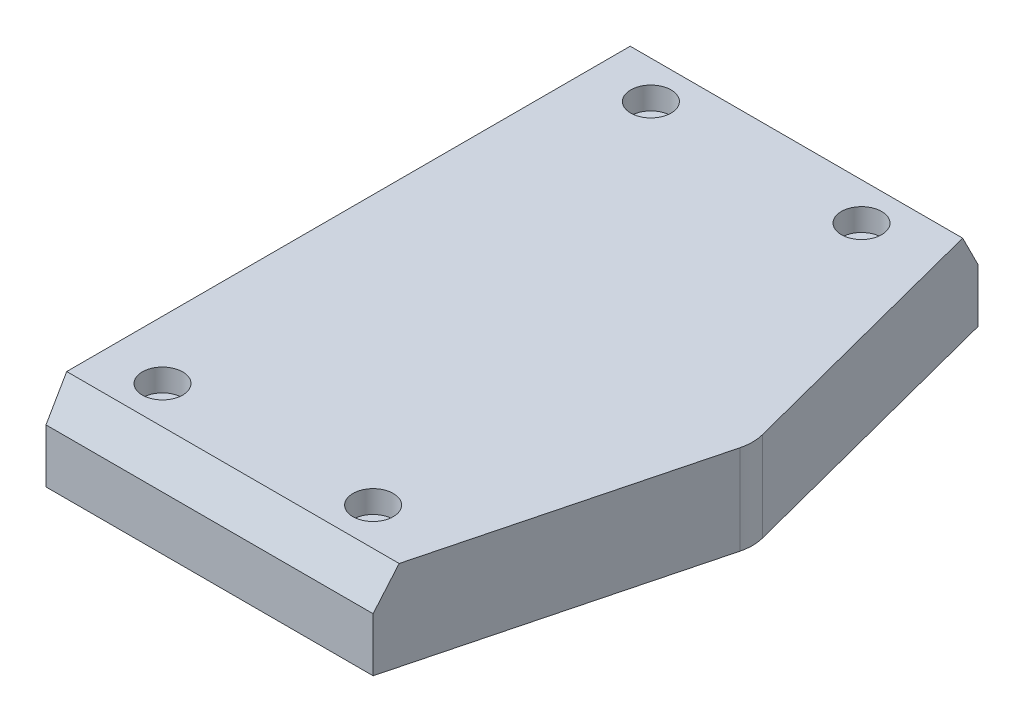
from build123d import *
from OCP.BRepFilletAPI import BRepFilletAPI_MakeChamfer

# Parameters (mm, degrees)
SALIENTE_EXTRUIR2_DEPTH     = 23
CROQUIS7_R                  = 20
CORTAR_EXTRUIR1_DEPTH       = 16
CROQUIS8_R                  = 10.25
CORTAR_EXTRUIR2_DEPTH       = 65.838641661
SALIENTE_EXTRUIR3_START     = 32
CROQUIS9_R                  = 20
CROQUIS9_R_2                = 3.075
CROQUIS9_R_3                = 10.25
SALIENTE_EXTRUIR3_DEPTH     = 32
CORTAR_EXTRUIR3_START       = -7
CROQUIS10_R                 = 20
CORTAR_EXTRUIR3_DEPTH       = 112.607172695
SALIENTE_EXTRUIR4_START     = 20
CROQUIS11_R                 = 3.075
CROQUIS11_R_2               = 20
SALIENTE_EXTRUIR4_DEPTH     = 20
CROQUIS12_R                 = 63
CORTAR_EXTRUIR4_DEPTH       = 3
CROQUIS13_R                 = 55
CORTAR_EXTRUIR5_DEPTH       = 10
SALIENTE_EXTRUIR5_START     = 10
SALIENTE_EXTRUIR5_DEPTH     = 10
CHAFL_N1_SIZE               = 8
CHAFL_N1_SIZE2              = 4.618802154
CROQUIS15_R                 = 6
CORTAR_EXTRUIR6_DEPTH       = 14.8
CORTAR_EXTRUIR7_REACH       = 233.334
CROQUIS17_R                 = 1.5
CORTAR_EXTRUIR9_REACH       = 225.907
CROQUIS19_R                 = 1.5
CORTAR_EXTRUIR10_START      = -50
CORTAR_EXTRUIR10_DEPTH      = 50
CROQUIS22_R                 = 3
CORTAR_EXTRUIR12_DEPTH      = 3
CROQUIS23_R                 = 3
CORTAR_EXTRUIR13_DEPTH      = 3
CROQUIS25_R                 = 2.5
CORTAR_EXTRUIR15_DEPTH      = 30
CROQUIS24_R                 = 2.5
CORTAR_EXTRUIR14_DEPTH      = 30
CROQUIS26_R                 = 2
CORTAR_EXTRUIR16_DEPTH      = 223.070371729
CROQUIS27_R                 = 3.5
CORTAR_EXTRUIR17_DEPTH      = 5
CORTAR_EXTRUIR18_DEPTH      = 3.25
CORTAR_EXTRUIR20_DEPTH      = 223.070371729
CORTAR_EXTRUIR20_DEPTH_BACK = 10
CROQUIS31_R                 = 2.5
CORTAR_EXTRUIR21_DEPTH      = 217.079267863
CROQUIS32_R                 = 4.5
CORTAR_EXTRUIR22_DEPTH      = 5
SALIENTE_EXTRUIR6_START     = 4
CROQUIS33_R                 = 55
CROQUIS33_R_2               = 6
SALIENTE_EXTRUIR6_DEPTH     = 4
SALIENTE_EXTRUIR7_START     = 3.35
CROQUIS34_R                 = 16.85
CROQUIS34_R_2               = 6
SALIENTE_EXTRUIR7_DEPTH     = 3.35
SALIENTE_EXTRUIR8_START     = 29
CROQUIS35_R                 = 10
CROQUIS35_R_2               = 6
SALIENTE_EXTRUIR8_DEPTH     = 29
CORTAR_EXTRUIR23_DEPTH      = 218.721088781
CORTAR_EXTRUIR23_DEPTH_BACK = 218.721088781
CROQUIS36_OUTSIDE_W         = 281.136
CROQUIS36_OUTSIDE_H         = 190.636
SALIENTE_EXTRUIR9_REACH     = 117.947
CROQUIS37_R                 = 20
VACIADO1_START              = 65
VACIADO1_DEPTH              = 12
VACIADO1_2_DEPTH            = 7
VACIADO1_START_2            = -12.766907344
VACIADO1_3_DEPTH            = 28.533814688


with BuildPart() as part:
    # Croquis2 → Saliente-Extruir2 (new body)
    with BuildSketch(Plane(origin=(0, 0, 0), x_dir=(1, 0, 0), z_dir=(0, 1, 0))):
        with BuildLine():
            Line((32.725022686, -35), (-35, -35))
            Line((-35, -35), (-35, 35))
            Line((-35, 35), (38, 35))
            Line((38, 35), (52.182846342, -19.705264464))
            ThreePointArc((52.182846342, -19.705264464), (38.869791903, -20.762030653), (32.5, -32.5))
            ThreePointArc((32.5, -32.5), (32.556369153, -33.755053307), (32.725022686, -35))
        make_face()
    extrude(amount=SALIENTE_EXTRUIR2_DEPTH)

    # Croquis7 → Cortar-Extruir1 (cut)
    with BuildSketch(Plane(origin=(0, 23, 0), x_dir=(1, 0, 0), z_dir=(0, 1, 0))):
        with Locations(Location((1.5, -1.5, 0), (0, 0, 270))):
            Circle(CROQUIS7_R)
    extrude(amount=-CORTAR_EXTRUIR1_DEPTH, mode=Mode.SUBTRACT)

    # Croquis8 → Cortar-Extruir2 (cut, through all)
    with BuildSketch(Plane(origin=(0, 7, 0), x_dir=(1, 0, 0), z_dir=(0, 1, 0))):
        with Locations(Location((1.5, -1.5, 0), (0, 0, 270))):
            Circle(CROQUIS8_R)
    extrude(amount=-CORTAR_EXTRUIR2_DEPTH, mode=Mode.SUBTRACT)

    # Croquis9 → Saliente-Extruir3 (add)
    with BuildSketch(Plane(origin=(0, 23, 0), x_dir=(1, 0, 0), z_dir=(0, 1, 0)).offset(SALIENTE_EXTRUIR3_START)):
        with BuildLine():
            Line((-35, 35), (-35, -100))
            Line((-35, -100), (38, -100))
            Line((38, -100), (54.849357366, -35.009621588))
            ThreePointArc((54.849357366, -35.009621588), (55.169388384, -32.5), (54.849357366, -29.990378412))
            Line((54.849357366, -29.990378412), (38, 35))
            Line((38, 35), (-35, 35))
        make_face()
        with Locations(Location((1.5, -1.5, 0), (0, 0, 270))):
            Circle(CROQUIS9_R, mode=Mode.SUBTRACT)
        with Locations(Location((46.5, -32.5, 0), (0, 0, 270))):
            Circle(CROQUIS9_R_2, mode=Mode.SUBTRACT)
        with Locations(Location((1.5, -63.5, 0), (0, 0, 90))):
            Circle(CROQUIS9_R_3, mode=Mode.SUBTRACT)
    extrude(amount=-SALIENTE_EXTRUIR3_DEPTH)

    # Croquis10 → Cortar-Extruir3 (cut, through all)
    with BuildSketch(Plane.XZ.offset(-23).offset(CORTAR_EXTRUIR3_START)):
        with Locations(Location((1.5, 63.5, 0), (0, 0, 90))):
            Circle(CROQUIS10_R)
    extrude(amount=-CORTAR_EXTRUIR3_DEPTH, mode=Mode.SUBTRACT)

    # Croquis11 → Saliente-Extruir4 (add)
    with BuildSketch(Plane(origin=(0, 55, 0), x_dir=(1, 0, 0), z_dir=(0, 1, 0)).offset(SALIENTE_EXTRUIR4_START)):
        with BuildLine():
            Line((123, 35), (-35, 35))
            Line((-35, 35), (-35, -100))
            Line((-35, -100), (123, -100))
            ThreePointArc((123, -100), (190.5, -32.5), (123, 35))
        make_face()
        with Locations(Location((46.5, -32.5, 0), (0, 0, 270))):
            Circle(CROQUIS11_R, mode=Mode.SUBTRACT)
        with Locations(Location((1.5, -63.5, 0), (0, 0, 270))):
            Circle(CROQUIS11_R_2, mode=Mode.SUBTRACT)
        with Locations(Location((1.5, -1.5, 0), (0, 0, 270))):
            Circle(CROQUIS11_R_2, mode=Mode.SUBTRACT)
    extrude(amount=-SALIENTE_EXTRUIR4_DEPTH)

    # Croquis12 → Cortar-Extruir4 (cut)
    with BuildSketch(Plane.XZ.offset(-55)):
        with Locations(Location((123, 32.5, 0), (0, 0, 270))):
            Circle(CROQUIS12_R)
    extrude(amount=-CORTAR_EXTRUIR4_DEPTH, mode=Mode.SUBTRACT)

    # Croquis13 → Cortar-Extruir5 (cut)
    with BuildSketch(Plane.XZ.offset(-58)):
        with Locations(Location((123, 32.5, 0), (0, 0, 270))):
            Circle(CROQUIS13_R)
    extrude(amount=-CORTAR_EXTRUIR5_DEPTH, mode=Mode.SUBTRACT)

    # Croquis14 → Saliente-Extruir5 (add)
    with BuildSketch(Plane(origin=(0, 75, 0), x_dir=(1, 0, 0), z_dir=(0, 1, 0)).offset(SALIENTE_EXTRUIR5_START)):
        with BuildLine():
            Line((-35, -100), (123, -100))
            ThreePointArc((123, -100), (190.5, -32.5), (123, 35))
            Line((123, 35), (-35, 35))
            Line((-35, 35), (-35, -100))
        make_face()
    extrude(amount=-SALIENTE_EXTRUIR5_DEPTH)

    # Chaflán1: one chamfer whose edges measure the first distance from different faces: ONE call of the kernel's chamfer builder (chamfer() names one face for all edges)
    chafl_n1_edges_1 = [part.edges().sort_by_distance(p)[0] for p in [
        (190.5, 85, 32.5),
    ]]
    chafl_n1_side_1 = [part.faces().sort_by_distance(p)[0] for p in [
        (190.5, 70, 32.5),
    ]]
    chafl_n1_edges_2 = [part.edges().sort_by_distance(p)[0] for p in [
        (44, 85, -35),
    ]]
    chafl_n1_side_2 = [part.faces().sort_by_distance(p)[0] for p in [
        (24.509708738, 50.509708738, -35),
    ]]
    chafl_n1_edges_3 = [part.edges().sort_by_distance(p)[0] for p in [
        (44, 85, 100),
    ]]
    chafl_n1_side_3 = [part.faces().sort_by_distance(p)[0] for p in [
        (29.969474279, 59.765969474, 100),
    ]]
    chafl_n1 = BRepFilletAPI_MakeChamfer(part.part.solid().wrapped)
    for e in chafl_n1_edges_1:
        chafl_n1.Add(CHAFL_N1_SIZE, CHAFL_N1_SIZE2, e.wrapped, chafl_n1_side_1[0].wrapped)  # the first distance lies on this face
    for e in chafl_n1_edges_2:
        chafl_n1.Add(CHAFL_N1_SIZE, CHAFL_N1_SIZE2, e.wrapped, chafl_n1_side_2[0].wrapped)  # the first distance lies on this face
    for e in chafl_n1_edges_3:
        chafl_n1.Add(CHAFL_N1_SIZE, CHAFL_N1_SIZE2, e.wrapped, chafl_n1_side_3[0].wrapped)  # the first distance lies on this face
    add(Compound.cast(chafl_n1.Shape()), mode=Mode.REPLACE)

    # Croquis15 → Cortar-Extruir6 (cut)
    with BuildSketch(Plane.XZ.offset(-68)):
        with Locations(Location((123, 32.5, 0), (0, 0, 270))):
            Circle(CROQUIS15_R)
    extrude(amount=-CORTAR_EXTRUIR6_DEPTH, mode=Mode.SUBTRACT)

    # Croquis17 → Cortar-Extruir7 (cut, up to next)
    with BuildSketch(Plane.XZ, mode=Mode.PRIVATE) as cortar_extruir7_sk1:
        with Locations(Location((16.5, 1.5, 0), (0, 0, 270))):
            Circle(CROQUIS17_R)
    cortar_extruir7_tool1 = extrude(cortar_extruir7_sk1.sketch, amount=-CORTAR_EXTRUIR7_REACH, mode=Mode.PRIVATE) & part.part
    # Croquis17 → Cortar-Extruir7 (cut, up to next)
    with BuildSketch(Plane.XZ, mode=Mode.PRIVATE) as cortar_extruir7_sk2:
        with Locations(Location((-6, -11.490381057, 0), (0, 0, 270))):
            Circle(CROQUIS17_R)
    cortar_extruir7_tool2 = extrude(cortar_extruir7_sk2.sketch, amount=-CORTAR_EXTRUIR7_REACH, mode=Mode.PRIVATE) & part.part
    # Croquis17 → Cortar-Extruir7 (cut, up to next)
    with BuildSketch(Plane.XZ, mode=Mode.PRIVATE) as cortar_extruir7_sk3:
        with Locations(Location((-6, 14.490381057, 0), (0, 0, 270))):
            Circle(CROQUIS17_R)
    cortar_extruir7_tool3 = extrude(cortar_extruir7_sk3.sketch, amount=-CORTAR_EXTRUIR7_REACH, mode=Mode.PRIVATE) & part.part
    # Croquis17 → Cortar-Extruir7 (cut, up to next)
    with BuildSketch(Plane.XZ, mode=Mode.PRIVATE) as cortar_extruir7_sk4:
        with Locations(Location((13.624355653, 8.5, 0), (0, 0, 270))):
            Circle(CROQUIS17_R)
    cortar_extruir7_tool4 = extrude(cortar_extruir7_sk4.sketch, amount=-CORTAR_EXTRUIR7_REACH, mode=Mode.PRIVATE) & part.part
    # Croquis17 → Cortar-Extruir7 (cut, up to next)
    with BuildSketch(Plane.XZ, mode=Mode.PRIVATE) as cortar_extruir7_sk5:
        with Locations(Location((1.5, -12.5, 0), (0, 0, 270))):
            Circle(CROQUIS17_R)
    cortar_extruir7_tool5 = extrude(cortar_extruir7_sk5.sketch, amount=-CORTAR_EXTRUIR7_REACH, mode=Mode.PRIVATE) & part.part
    # Croquis17 → Cortar-Extruir7 (cut, up to next)
    with BuildSketch(Plane.XZ, mode=Mode.PRIVATE) as cortar_extruir7_sk6:
        with Locations(Location((-10.624355653, 8.5, 0), (0, 0, 270))):
            Circle(CROQUIS17_R)
    cortar_extruir7_tool6 = extrude(cortar_extruir7_sk6.sketch, amount=-CORTAR_EXTRUIR7_REACH, mode=Mode.PRIVATE) & part.part
    add(cortar_extruir7_tool1.solids().sort_by_distance((16.5, 0, 1.5))[0], mode=Mode.SUBTRACT)
    add(cortar_extruir7_tool2.solids().sort_by_distance((-6, 0, -11.490381))[0], mode=Mode.SUBTRACT)
    add(cortar_extruir7_tool3.solids().sort_by_distance((-6, 0, 14.490381))[0], mode=Mode.SUBTRACT)
    add(cortar_extruir7_tool4.solids().sort_by_distance((13.624356, 0, 8.5))[0], mode=Mode.SUBTRACT)
    add(cortar_extruir7_tool5.solids().sort_by_distance((1.5, 0, -12.5))[0], mode=Mode.SUBTRACT)
    add(cortar_extruir7_tool6.solids().sort_by_distance((-10.624356, 0, 8.5))[0], mode=Mode.SUBTRACT)

    # Croquis19 → Cortar-Extruir9 (cut, up to next)
    with BuildSketch(Plane.XZ.offset(-23), mode=Mode.PRIVATE) as cortar_extruir9_sk1:
        with Locations(Location((16.5, 63.5, 0), (0, 0, 270))):
            Circle(CROQUIS19_R)
    cortar_extruir9_tool1 = extrude(cortar_extruir9_sk1.sketch, amount=-CORTAR_EXTRUIR9_REACH, mode=Mode.PRIVATE) & part.part
    # Croquis19 → Cortar-Extruir9 (cut, up to next)
    with BuildSketch(Plane.XZ.offset(-23), mode=Mode.PRIVATE) as cortar_extruir9_sk2:
        with Locations(Location((-6, 50.509618943, 0), (0, 0, 270))):
            Circle(CROQUIS19_R)
    cortar_extruir9_tool2 = extrude(cortar_extruir9_sk2.sketch, amount=-CORTAR_EXTRUIR9_REACH, mode=Mode.PRIVATE) & part.part
    # Croquis19 → Cortar-Extruir9 (cut, up to next)
    with BuildSketch(Plane.XZ.offset(-23), mode=Mode.PRIVATE) as cortar_extruir9_sk3:
        with Locations(Location((-6, 76.490381057, 0), (0, 0, 270))):
            Circle(CROQUIS19_R)
    cortar_extruir9_tool3 = extrude(cortar_extruir9_sk3.sketch, amount=-CORTAR_EXTRUIR9_REACH, mode=Mode.PRIVATE) & part.part
    # Croquis19 → Cortar-Extruir9 (cut, up to next)
    with BuildSketch(Plane.XZ.offset(-23), mode=Mode.PRIVATE) as cortar_extruir9_sk4:
        with Locations(Location((13.624355653, 70.5, 0), (0, 0, 270))):
            Circle(CROQUIS19_R)
    cortar_extruir9_tool4 = extrude(cortar_extruir9_sk4.sketch, amount=-CORTAR_EXTRUIR9_REACH, mode=Mode.PRIVATE) & part.part
    # Croquis19 → Cortar-Extruir9 (cut, up to next)
    with BuildSketch(Plane.XZ.offset(-23), mode=Mode.PRIVATE) as cortar_extruir9_sk5:
        with Locations(Location((1.5, 49.5, 0), (0, 0, 270))):
            Circle(CROQUIS19_R)
    cortar_extruir9_tool5 = extrude(cortar_extruir9_sk5.sketch, amount=-CORTAR_EXTRUIR9_REACH, mode=Mode.PRIVATE) & part.part
    # Croquis19 → Cortar-Extruir9 (cut, up to next)
    with BuildSketch(Plane.XZ.offset(-23), mode=Mode.PRIVATE) as cortar_extruir9_sk6:
        with Locations(Location((-10.624355653, 70.5, 0), (0, 0, 270))):
            Circle(CROQUIS19_R)
    cortar_extruir9_tool6 = extrude(cortar_extruir9_sk6.sketch, amount=-CORTAR_EXTRUIR9_REACH, mode=Mode.PRIVATE) & part.part
    add(cortar_extruir9_tool1.solids().sort_by_distance((16.5, 23, 63.5))[0], mode=Mode.SUBTRACT)
    add(cortar_extruir9_tool2.solids().sort_by_distance((-6, 23, 50.509619))[0], mode=Mode.SUBTRACT)
    add(cortar_extruir9_tool3.solids().sort_by_distance((-6, 23, 76.490381))[0], mode=Mode.SUBTRACT)
    add(cortar_extruir9_tool4.solids().sort_by_distance((13.624356, 23, 70.5))[0], mode=Mode.SUBTRACT)
    add(cortar_extruir9_tool5.solids().sort_by_distance((1.5, 23, 49.5))[0], mode=Mode.SUBTRACT)
    add(cortar_extruir9_tool6.solids().sort_by_distance((-10.624356, 23, 70.5))[0], mode=Mode.SUBTRACT)

    # Croquis20 → Cortar-Extruir10 (cut)
    with BuildSketch(Plane.XZ.offset(CORTAR_EXTRUIR10_START)):
        with BuildLine():
            Line((42.3656995, 5.747113524), (39.773106907, -4.252886476))
            ThreePointArc((39.773106907, -4.252886476), (38.705054743, -5.872620854), (36.869116213, -6.5))
            Line((36.869116213, -6.5), (19.83030278, -6.5))
            ThreePointArc((19.83030278, -6.5), (21.5, 1.5), (19.83030278, 9.5))
            Line((19.83030278, 9.5), (39.461708805, 9.5))
            ThreePointArc((39.461708805, 9.5), (41.834329659, 8.33593853), (42.3656995, 5.747113524))
        make_face()
    extrude(amount=CORTAR_EXTRUIR10_DEPTH, mode=Mode.SUBTRACT)

    # Croquis22 → Cortar-Extruir12 (cut)
    with BuildSketch(Plane.XZ):
        with Locations(Location((-6, 14.490381057, 0), (0, 0, 270))):
            Circle(CROQUIS22_R)
        with Locations(Location((-10.624355653, 8.5, 0), (0, 0, 270))):
            Circle(CROQUIS22_R)
        with Locations(Location((-6, -11.490381057, 0), (0, 0, 270))):
            Circle(CROQUIS22_R)
        with Locations(Location((1.5, -12.5, 0), (0, 0, 270))):
            Circle(CROQUIS22_R)
        with Locations(Location((16.5, 1.5, 0), (0, 0, 270))):
            Circle(CROQUIS22_R)
        with Locations(Location((13.624355653, 8.5, 0), (0, 0, 270))):
            Circle(CROQUIS22_R)
    extrude(amount=-CORTAR_EXTRUIR12_DEPTH, mode=Mode.SUBTRACT)

    # Croquis23 → Cortar-Extruir13 (cut)
    with BuildSketch(Plane.XZ.offset(-23)):
        with Locations(Location((-6, 76.490381057, 0), (0, 0, 270))):
            Circle(CROQUIS23_R)
        with Locations(Location((-10.624355653, 70.5, 0), (0, 0, 270))):
            Circle(CROQUIS23_R)
        with Locations(Location((-6, 50.509618943, 0), (0, 0, 270))):
            Circle(CROQUIS23_R)
        with Locations(Location((1.5, 49.5, 0), (0, 0, 270))):
            Circle(CROQUIS23_R)
        with Locations(Location((16.5, 63.5, 0), (0, 0, 270))):
            Circle(CROQUIS23_R)
        with Locations(Location((13.624355653, 70.5, 0), (0, 0, 270))):
            Circle(CROQUIS23_R)
    extrude(amount=-CORTAR_EXTRUIR13_DEPTH, mode=Mode.SUBTRACT)

    # Croquis25 → Cortar-Extruir15 (cut)
    with BuildSketch(Plane.XZ.offset(-23)):
        with Locations(Location((-28.75, 63.5, 0), (0, 0, 270))):
            Circle(CROQUIS25_R)
        with Locations(Location((29, 47, 0), (0, 0, 270))):
            Circle(CROQUIS25_R)
    extrude(amount=-CORTAR_EXTRUIR15_DEPTH, mode=Mode.SUBTRACT)

    # Croquis24 → Cortar-Extruir14 (cut)
    with BuildSketch(Plane.XZ):
        with Locations(Location((-28.75, 1.5, 0), (0, 0, 270))):
            Circle(CROQUIS24_R)
        with Locations(Location((25, 25, 0), (0, 0, 270))):
            Circle(CROQUIS24_R)
    extrude(amount=-CORTAR_EXTRUIR14_DEPTH, mode=Mode.SUBTRACT)

    # Croquis26 → Cortar-Extruir16 (cut, through all)
    with BuildSketch(Plane.XZ.offset(-55)):
        with Locations(Location((54.186793756, 85.381197846, 0), (0, 0, 270))):
            Circle(CROQUIS26_R)
        with Locations(Location((58.853460423, 67.381197846, 0), (0, 0, 270))):
            Circle(CROQUIS26_R)
        with Locations(Location((58.853460423, -2.381197846, 0), (0, 0, 90))):
            Circle(CROQUIS26_R)
        with Locations(Location((54.186793756, -20.381197846, 0), (0, 0, 90))):
            Circle(CROQUIS26_R)
    extrude(amount=-CORTAR_EXTRUIR16_DEPTH, mode=Mode.SUBTRACT)

    # Croquis27 → Cortar-Extruir17 (cut)
    with BuildSketch(Plane(origin=(0, 85, 0), x_dir=(1, 0, 0), z_dir=(0, 1, 0))):
        with Locations(Location((54.186793756, 20.381197846, 0), (0, 0, 270))):
            Circle(CROQUIS27_R)
        with Locations(Location((58.853460423, 2.381197846, 0), (0, 0, 270))):
            Circle(CROQUIS27_R)
        with Locations(Location((58.853460423, -67.381197846, 0), (0, 0, 270))):
            Circle(CROQUIS27_R)
        with Locations(Location((54.186793756, -85.381197846, 0), (0, 0, 270))):
            Circle(CROQUIS27_R)
    extrude(amount=-CORTAR_EXTRUIR17_DEPTH, mode=Mode.SUBTRACT)

    # Croquis28 → Cortar-Extruir18 (cut)
    with BuildSketch(Plane.XZ.offset(-55)):
        Polygon((55.222779206, 81.385253968), (58.165375392, 84.280415625), (57.129389942, 88.276359503), (53.150808306, 89.377141725), (50.20821212, 86.481980068), (51.24419757, 82.48603619), align=None)
        Polygon((59.889445873, 63.385253968), (62.832042059, 66.280415625), (61.796056609, 70.276359503), (57.817474973, 71.377141725), (54.874878787, 68.481980068), (55.910864237, 64.48603619), align=None)
        Polygon((59.889445873, 1.614746032), (55.910864237, 0.51396381), (54.874878787, -3.481980068), (57.817474973, -6.377141725), (61.796056609, -5.276359503), (62.832042059, -1.280415625), align=None)
        Polygon((55.222779206, -16.385253968), (51.24419757, -17.48603619), (50.20821212, -21.481980068), (53.150808306, -24.377141725), (57.129389942, -23.276359503), (58.165375392, -19.280415625), align=None)
    extrude(amount=-CORTAR_EXTRUIR18_DEPTH, mode=Mode.SUBTRACT)

    # Croquis30 → Cortar-Extruir20 (cut, two sides: drawn at the far end of the back side and taken through both)
    with BuildSketch(Plane.XZ.offset(-55).offset(-CORTAR_EXTRUIR20_DEPTH_BACK)):
        with BuildLine():
            Line((123, 100), (-35, 100))
            Line((-35, 100), (-35, -35))
            Line((-35, -35), (123, -35))
            ThreePointArc((123, -35), (55.5, 32.5), (123, 100))
        make_face()
    extrude(amount=CORTAR_EXTRUIR20_DEPTH + CORTAR_EXTRUIR20_DEPTH_BACK, mode=Mode.SUBTRACT)

    # Croquis31 → Cortar-Extruir21 (cut, through all)
    with BuildSketch(Plane.XZ.offset(-65)):
        with Locations(Location((-22, 87, 0), (0, 0, 270))):
            Circle(CROQUIS31_R)
        with Locations(Location((25, 87, 0), (0, 0, 270))):
            Circle(CROQUIS31_R)
        with Locations(Location((25, -22, 0), (0, 0, 90))):
            Circle(CROQUIS31_R)
        with Locations(Location((-22, -22, 0), (0, 0, 90))):
            Circle(CROQUIS31_R)
    extrude(amount=-CORTAR_EXTRUIR21_DEPTH, mode=Mode.SUBTRACT)

    # Croquis32 → Cortar-Extruir22 (cut)
    with BuildSketch(Plane(origin=(0, 85, 0), x_dir=(1, 0, 0), z_dir=(0, 1, 0))):
        with Locations(Location((-22, 22, 0), (0, 0, 270))):
            Circle(CROQUIS32_R)
        with Locations(Location((25, 22, 0), (0, 0, 270))):
            Circle(CROQUIS32_R)
        with Locations(Location((-22, -87, 0), (0, 0, 270))):
            Circle(CROQUIS32_R)
        with Locations(Location((25, -87, 0), (0, 0, 270))):
            Circle(CROQUIS32_R)
    extrude(amount=-CORTAR_EXTRUIR22_DEPTH, mode=Mode.SUBTRACT)

    # Croquis33 → Saliente-Extruir6 (add)
    with BuildSketch(Plane.XZ.offset(-68).offset(SALIENTE_EXTRUIR6_START)):
        with Locations(Location((123, 32.5, 0), (0, 0, 270))):
            Circle(CROQUIS33_R)
        with Locations(Location((123, 32.5, 0), (0, 0, 270))):
            Circle(CROQUIS33_R_2, mode=Mode.SUBTRACT)
    extrude(amount=-SALIENTE_EXTRUIR6_DEPTH)

    # Croquis34 → Saliente-Extruir7 (add)
    with BuildSketch(Plane.XZ.offset(-64).offset(SALIENTE_EXTRUIR7_START)):
        with Locations(Location((123, 32.5, 0), (0, 0, 270))):
            Circle(CROQUIS34_R)
        with Locations(Location((123, 32.5, 0), (0, 0, 270))):
            Circle(CROQUIS34_R_2, mode=Mode.SUBTRACT)
    extrude(amount=-SALIENTE_EXTRUIR7_DEPTH)

    # Croquis35 → Saliente-Extruir8 (add)
    with BuildSketch(Plane.XZ.offset(-60.65).offset(SALIENTE_EXTRUIR8_START)):
        with Locations(Location((123, 32.5, 0), (0, 0, 90))):
            Circle(CROQUIS35_R)
        with Locations(Location((123, 32.5, 0), (0, 0, 270))):
            Circle(CROQUIS35_R_2, mode=Mode.SUBTRACT)
    extrude(amount=-SALIENTE_EXTRUIR8_DEPTH)

    # Croquis36 outside → Cortar-Extruir23 (cut, two sides: drawn at the far end of the back side and taken through both)
    with BuildSketch(Plane.XZ.offset(-65).offset(-CORTAR_EXTRUIR23_DEPTH_BACK)):
        with Locations((77.75, 32.5)):
            Rectangle(CROQUIS36_OUTSIDE_W, CROQUIS36_OUTSIDE_H)
        with BuildLine():
            Line((38, -35), (54.849357366, 29.990378412))
            ThreePointArc((54.849357366, 29.990378412), (55.169388384, 32.5), (54.849357366, 35.009621588))
            Line((54.849357366, 35.009621588), (38, 100))
            Line((38, 100), (-35, 100))
            Line((-35, 100), (-35, -35))
            Line((-35, -35), (38, -35))
        make_face(mode=Mode.SUBTRACT)
    extrude(amount=CORTAR_EXTRUIR23_DEPTH + CORTAR_EXTRUIR23_DEPTH_BACK, mode=Mode.SUBTRACT)

    # Croquis37 → Saliente-Extruir9 (add, up to next)
    with BuildSketch(Plane.XZ.offset(-65), mode=Mode.PRIVATE) as saliente_extruir9_sk1:
        with Locations((1.5, 1.5)):
            Circle(CROQUIS37_R)
    saliente_extruir9_tool1 = extrude(saliente_extruir9_sk1.sketch, amount=-SALIENTE_EXTRUIR9_REACH, mode=Mode.PRIVATE) - part.part
    # Croquis37 → Saliente-Extruir9 (add, up to next)
    with BuildSketch(Plane.XZ.offset(-65), mode=Mode.PRIVATE) as saliente_extruir9_sk2:
        with Locations((1.5, 63.5)):
            Circle(CROQUIS37_R)
    saliente_extruir9_tool2 = extrude(saliente_extruir9_sk2.sketch, amount=-SALIENTE_EXTRUIR9_REACH, mode=Mode.PRIVATE) - part.part
    add(saliente_extruir9_tool1.solids().sort_by_distance((1.5, 65, 1.5))[0])
    add(saliente_extruir9_tool2.solids().sort_by_distance((1.5, 65, 63.5))[0])

    # Vaciado1: read off the stored shape, not the designer's step
    # Vaciado1 outline → Vaciado1 (cut)
    with BuildSketch(Plane(origin=(0, 0, 0), x_dir=(1, 0, 0), z_dir=(0, 1, 0)).offset(VACIADO1_START)):
        with BuildLine():
            Line((-27, 10.543560763), (-27, -75.543560763))
            ThreePointArc((-27, -75.543560763), (-13.161165235, -78.161165235), (-10.543560763, -92))
            Line((-10.543560763, -92), (13.543560763, -92))
            ThreePointArc((13.543560763, -92), (18.73472068, -76.183518361), (35.037347766, -79.550057059))
            Line((35.037347766, -79.550057059), (44.415530092, -43.377068089))
            ThreePointArc((44.415530092, -43.377068089), (35.425, -32.5), (44.415530092, -21.622931911))
            Line((44.415530092, -21.622931911), (35.037347766, 14.550057059))
            ThreePointArc((35.037347766, 14.550057059), (18.73472068, 11.183518361), (13.543560763, 27))
            Line((13.543560763, 27), (-10.543560763, 27))
            ThreePointArc((-10.543560763, 27), (-13.161165235, 13.161165235), (-27, 10.543560763))
        make_face()
    extrude(amount=VACIADO1_DEPTH, mode=Mode.SUBTRACT)

    # Vaciado1 2 outline → Vaciado1 2 (cut)
    with BuildSketch(Plane(origin=(0, 0, 0), x_dir=(1, 0, 0), z_dir=(0, 1, 0)).offset(VACIADO1_START)):
        with BuildLine():
            Line((-27, -75.543560763), (-27, -77.766907344))
            ThreePointArc((-27, -77.766907344), (-14.575378798, -79.575378798), (-12.766907344, -92))
            Line((-12.766907344, -92), (-10.543560763, -92))
            ThreePointArc((-10.543560763, -92), (-13.161165235, -78.161165235), (-27, -75.543560763))
        make_face()
        with BuildLine():
            Line((-27, 12.766907344), (-27, 10.543560763))
            ThreePointArc((-27, 10.543560763), (-13.161165235, 13.161165235), (-10.543560763, 27))
            Line((-10.543560763, 27), (-12.766907344, 27))
            ThreePointArc((-12.766907344, 27), (-14.575378798, 14.575378798), (-27, 12.766907344))
        make_face()
        with BuildLine():
            ThreePointArc((35.037347766, -79.550057059), (18.73472068, -76.183518361), (13.543560763, -92))
            Line((13.543560763, -92), (15.766907344, -92))
            ThreePointArc((15.766907344, -92), (20.107244927, -77.70963145), (34.346398818, -82.21514586))
            Line((34.346398818, -82.21514586), (35.037347766, -79.550057059))
        make_face()
        with BuildLine():
            Line((15.766907344, 27), (13.543560763, 27))
            ThreePointArc((13.543560763, 27), (18.73472068, 11.183518361), (35.037347766, 14.550057059))
            Line((35.037347766, 14.550057059), (34.346398818, 17.21514586))
            ThreePointArc((34.346398818, 17.21514586), (20.107244927, 12.70963145), (15.766907344, 27))
        make_face()
    extrude(amount=VACIADO1_2_DEPTH, mode=Mode.SUBTRACT)

    # Vaciado1 3 outline → Vaciado1 3 (add)
    with BuildSketch(Plane.YZ.offset(VACIADO1_START_2)):
        Polygon((77, -27), (77, -25.762395693), (74.856406461, -27), align=None)
        Polygon((74.856406461, 92), (77, 90.762395693), (77, 92), align=None)
    extrude(amount=VACIADO1_3_DEPTH)


solid = part.part
